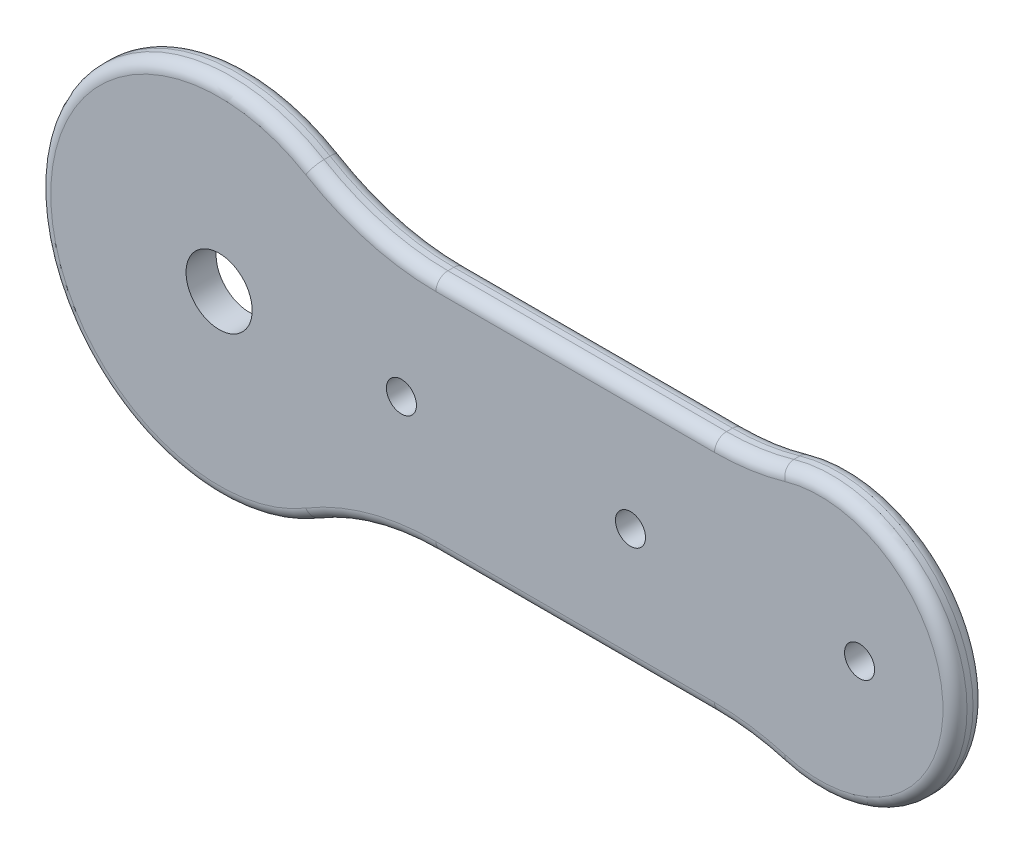
from build123d import *

# Parameters (mm, degrees)
SKETCH1_R           = 11
SKETCH1_R_2         = 5
BOSS_EXTRUDE1_DEPTH = 10
FILLET1_R           = 80
FILLET2_R           = 4


with BuildPart() as part:
    # Sketch1 → Boss-Extrude1 (new body)
    with BuildSketch(Plane.XY):
        with BuildLine():
            ThreePointArc((-55.17864045, 40), (-159.9, 0), (-55.17864045, -40))
            Line((-55.17864045, -40), (79.284471872, -40))
            ThreePointArc((79.284471872, -40), (144.9, 0), (79.284471872, 40))
            Line((79.284471872, 40), (-55.17864045, 40))
        make_face()
        with Locations((-99.9, 0)):
            Circle(SKETCH1_R, mode=Mode.SUBTRACT)
        with Locations((-39.25, 0)):
            Circle(SKETCH1_R_2, mode=Mode.SUBTRACT)
        with Locations((36.95, 0)):
            Circle(SKETCH1_R_2, mode=Mode.SUBTRACT)
        with Locations((113.15, 0)):
            Circle(SKETCH1_R_2, mode=Mode.SUBTRACT)
    extrude(amount=BOSS_EXTRUDE1_DEPTH)

    # Fillet1
    fillet1_edges = [part.edges().sort_by_distance(p)[0] for p in [
        (-55.17864045, -40, 5),
        (-55.17864045, 40, 5),
        (79.284471872, -40, 5),
        (79.284471872, 40, 5),
    ]]
    fillet(fillet1_edges, radius=FILLET1_R)

    # Fillet2
    fillet2_edges = [part.edges().sort_by_distance(p)[0] for p in [
        (18.555512755, 40, 0),
        (-159.9, 0, 0),
        (18.555512755, -40, 0),
        (144.9, 0, 0),
        (144.9, 0, 10),
        (18.555512755, -40, 10),
        (-159.9, 0, 10),
        (18.555512755, 40, 10),
        (-49.169873844, -42.910071067, 0),
        (-49.169873844, -42.910071067, 10),
        (-49.169873844, 42.910071067, 0),
        (-49.169873844, 42.910071067, 10),
        (76.213708499, -40.804040507, 0),
        (76.213708499, -40.804040507, 10),
        (76.213708499, 40.804040507, 0),
        (76.213708499, 40.804040507, 10),
    ]]
    fillet(fillet2_edges, radius=FILLET2_R)


solid = part.part
